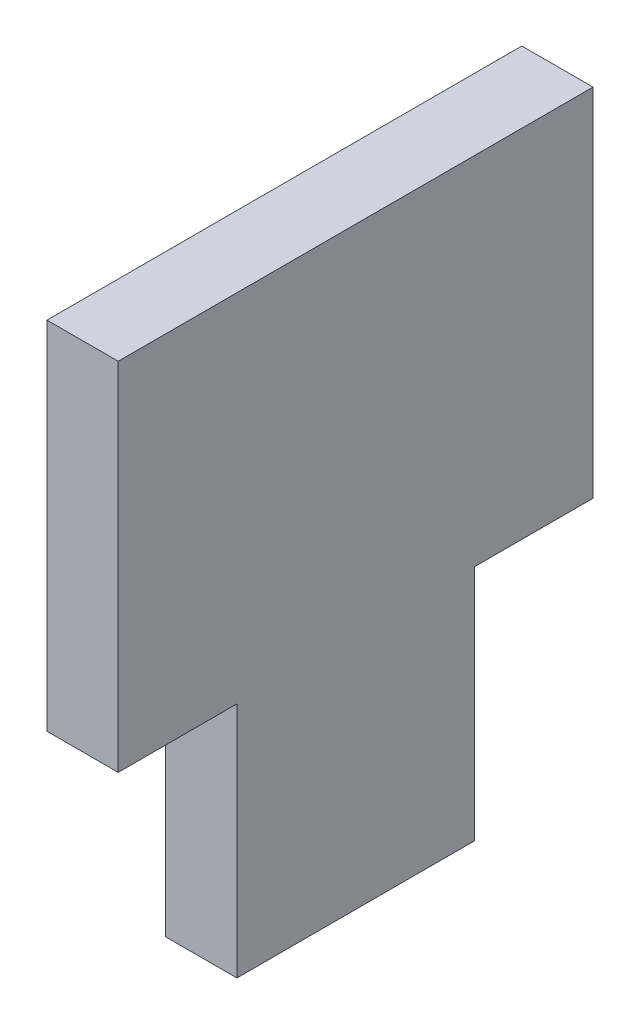
from build123d import *

# Parameters (mm, degrees)
BOSS_EXTRUDE1_DEPTH = 3


with BuildPart() as part:
    # Sketch1 → Boss-Extrude1 (new body)
    with BuildSketch(Plane(origin=(0, 0, 0), x_dir=(0, 0, -1), z_dir=(1, 0, 0))):
        Polygon((-5, -7.5), (-5, -17.5), (5, -17.5), (5, -7.5), (10, -7.5), (10, 7.5), (-10, 7.5), (-10, -7.5), align=None)
    extrude(amount=BOSS_EXTRUDE1_DEPTH)


solid = part.part
